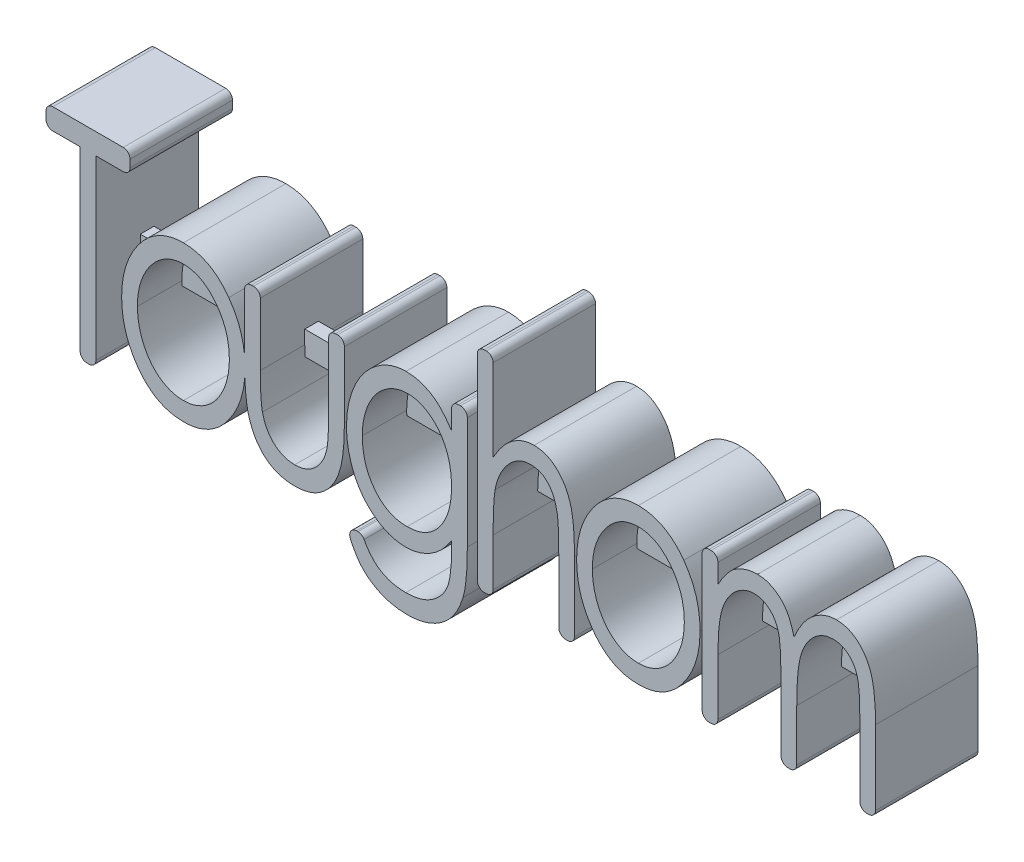
from build123d import *

# Parameters (mm, degrees)
SKETCH1_W           = 115
SKETCH1_H           = 3.5
BOSS_EXTRUDE1_DEPTH = 1
BOSS_EXTRUDE2_DEPTH = 7.5
FILLET10_R          = 1
BOSS_EXTRUDE3_DEPTH = 2
FILLET12_R          = 1


with BuildPart() as part:
    # Sketch1 → Boss-Extrude1 (new, symmetric)
    with BuildSketch(Plane.XY):
        Rectangle(SKETCH1_W, SKETCH1_H)
    extrude(amount=BOSS_EXTRUDE1_DEPTH, both=True)

    # Sketch2 → Boss-Extrude2 (add, symmetric)
    # profile 1 of 7: a face of its own
    with BuildSketch(Plane.XY):
        Polygon((-62.858031997, 14.923076923), (-62.858031997, 18), (-50.550339689, 18), (-50.550339689, 14.923076923), (-55.550339689, 14.923076923), (-55.550339689, -12), (-57.858031997, -12), (-57.858031997, 14.923076923), align=None)
    # profile 2 of 7: a face of its own
    with BuildSketch(Plane.XY):
        with BuildLine():
            add(Edge.make_bspline(
                [(-42.736637766, 10.307692308), (-42.409263923, 10.298740618), (-41.763692143, 10.281088145), (-40.819559803, 10.097580883), (-39.917803435, 9.814742237), (-39.054989577, 9.42441453), (-38.246546095, 8.902157468), (-37.472897868, 8.282226001), (-36.745989244, 7.542629901), (-36.316564213, 6.983223145), (-36.096012766, 6.695913462)],
                knots=[0, 0, 0, 0, 0.997600737, 1.967239891, 2.921995117, 3.876339565, 4.846055743, 5.850055787, 6.895794904, 8, 8, 8, 8], degree=3))
            add(Edge.make_bspline(
                [(-36.096012766, 6.695913462), (-35.904597218, 6.41866807), (-35.522033963, 5.864565226), (-35.041158438, 4.977646114), (-34.619936034, 4.060624866), (-34.283343934, 3.100774444), (-34.027451181, 2.102655282), (-33.840992187, 1.068428588), (-33.722646711, -0.00204681), (-33.710396667, -0.729656481), (-33.704185843, -1.098557692)],
                knots=[0, 0, 0, 0, 0.974492422, 1.947621278, 2.915467704, 3.892853539, 4.88708504, 5.894700399, 6.932604111, 8, 8, 8, 8], degree=3))
            add(Edge.make_bspline(
                [(-33.704185843, -1.098557692), (-33.713176409, -1.46940431), (-33.730908568, -2.200827774), (-33.844239125, -3.28065513), (-34.044937491, -4.324938564), (-34.319500349, -5.334566711), (-34.676197584, -6.310239889), (-35.115953435, -7.245313335), (-35.630121351, -8.149138297), (-36.218409013, -9.004070665), (-36.864426402, -9.793873704), (-37.566793046, -10.485855573), (-38.314068785, -11.075267355), (-39.113838683, -11.551333581), (-39.953700779, -11.928915161), (-40.840397543, -12.194320521), (-41.773357227, -12.353522586), (-42.411489211, -12.37412023), (-42.736637766, -12.384615385)],
                knots=[0, 0, 0, 0, 1.107894965, 2.185109244, 3.239066719, 4.281441704, 5.307577007, 6.338291467, 7.364845487, 8.410599108, 9.435040353, 10.408337498, 11.35046711, 12.27106388, 13.181883432, 14.094411748, 15.029042138, 16, 16, 16, 16], degree=3))
            add(Edge.make_bspline(
                [(-42.736637766, -12.384615385), (-43.061804994, -12.374181995), (-43.699973625, -12.353705571), (-44.634565299, -12.193301725), (-45.524003788, -11.930248909), (-46.365333092, -11.551118374), (-47.165501362, -11.075586406), (-47.912552212, -10.48386695), (-48.621063929, -9.796116193), (-49.266577085, -9.003753868), (-49.855255124, -8.149222162), (-50.369319504, -7.245290936), (-50.809103004, -6.310245867), (-51.165792829, -5.334565084), (-51.440357704, -4.324939008), (-51.641055519, -3.280655009), (-51.754386225, -2.200827805), (-51.772118364, -1.469404321), (-51.78110892, -1.098557692)],
                knots=[0, 0, 0, 0, 0.97035087, 1.904396978, 2.822082662, 3.732332818, 4.652354079, 5.593894721, 6.570857939, 7.594658757, 8.639758628, 9.6656709, 10.695741012, 11.721234828, 12.762958176, 13.816256772, 14.892797633, 16, 16, 16, 16], degree=3))
            add(Edge.make_bspline(
                [(-51.78110892, -1.098557692), (-51.774905501, -0.731643798), (-51.762637137, -0.006006344), (-51.643489543, 1.062201807), (-51.461029112, 2.096021133), (-51.192690647, 3.086689508), (-50.864563857, 4.046754672), (-50.446943576, 4.963133549), (-49.961376615, 5.847480599), (-49.580401055, 6.400472404), (-49.389281997, 6.677884615)],
                knots=[0, 0, 0, 0, 1.063876162, 2.104004247, 3.113779066, 4.10599887, 5.078075217, 6.053289624, 7.023419104, 8, 8, 8, 8], degree=3))
            add(Edge.make_bspline(
                [(-49.389281997, 6.677884615), (-49.169165257, 6.967613653), (-48.741484234, 7.530549534), (-48.009944394, 8.269124489), (-47.240400528, 8.899313236), (-46.423342687, 9.414909601), (-45.563347654, 9.816626366), (-44.659438047, 10.097002941), (-43.713693544, 10.281621688), (-43.06604951, 10.298902668), (-42.736637766, 10.307692308)],
                knots=[0, 0, 0, 0, 1.105877608, 2.148691041, 3.153713737, 4.125868282, 5.080095171, 6.03217926, 6.999105637, 8, 8, 8, 8], degree=3))
        make_face()
        with BuildLine():
            add(Edge.make_bspline(
                [(-42.742647381, 7.615384615), (-42.969560295, 7.607094273), (-43.418582101, 7.590689105), (-44.078549469, 7.465807077), (-44.712895673, 7.268292333), (-45.322555783, 6.986920656), (-45.90572899, 6.623247617), (-46.466983916, 6.183043013), (-46.998823912, 5.65774141), (-47.502310324, 5.065095844), (-47.962625282, 4.413225874), (-48.364675948, 3.720554819), (-48.710774283, 2.998450485), (-48.9856005, 2.238215651), (-49.212833485, 1.448621728), (-49.355117093, 0.620003865), (-49.459391677, -0.236537497), (-49.468686417, -0.819772075), (-49.473416612, -1.116586538)],
                knots=[0, 0, 0, 0, 0.892051984, 1.765218143, 2.632427219, 3.499707879, 4.398381485, 5.329923715, 6.299412897, 7.333506008, 8.385012576, 9.433681383, 10.480424421, 11.529892124, 12.610027243, 13.707297798, 14.833218744, 16, 16, 16, 16], degree=3))
            add(Edge.make_bspline(
                [(-49.473416612, -1.116586538), (-49.464557495, -1.4999776), (-49.447022399, -2.258834238), (-49.260842873, -3.372715125), (-48.991257552, -4.451722721), (-48.593645714, -5.471959163), (-48.105074625, -6.417470676), (-47.536878801, -7.268771774), (-46.87422839, -7.994452623), (-46.145730559, -8.608389632), (-45.353607995, -9.08853655), (-44.517237087, -9.435997987), (-43.643596622, -9.65831353), (-43.044442208, -9.680920522), (-42.742647381, -9.692307692)],
                knots=[0, 0, 0, 0, 1.139368929, 2.255184748, 3.350673064, 4.442866719, 5.503577089, 6.511720108, 7.47770502, 8.416871705, 9.336594054, 10.220769263, 11.103799257, 12, 12, 12, 12], degree=3))
            add(Edge.make_bspline(
                [(-42.742647381, -9.692307692), (-42.440832041, -9.680950864), (-41.841636901, -9.65840411), (-40.968298568, -9.435641682), (-40.132353082, -9.090553062), (-39.344729426, -8.604154234), (-38.610896282, -7.998883444), (-37.955159864, -7.266175806), (-37.385925958, -6.417864165), (-36.89724727, -5.471977989), (-36.501892143, -4.450743056), (-36.222470443, -3.373748881), (-36.038805116, -2.258696715), (-36.020916083, -1.499931441), (-36.01187815, -1.116586538)],
                knots=[0, 0, 0, 0, 0.896424748, 1.779675456, 2.664071664, 3.578931997, 4.522916774, 5.48514584, 6.493540845, 7.554516339, 8.646982988, 9.744251569, 10.860346286, 12, 12, 12, 12], degree=3))
            add(Edge.make_bspline(
                [(-36.01187815, -1.116586538), (-36.016864819, -0.819826798), (-36.026663525, -0.236699749), (-36.127333392, 0.620984495), (-36.282972801, 1.44658327), (-36.495592063, 2.240756223), (-36.782730164, 2.996999325), (-37.126310974, 3.720524529), (-37.528024574, 4.415177086), (-37.995647014, 5.063215717), (-38.498200515, 5.657890972), (-39.030211893, 6.183334678), (-39.590943633, 6.620964416), (-40.17081999, 6.990553477), (-40.781675464, 7.265231981), (-41.414266817, 7.467180998), (-42.070844219, 7.590038902), (-42.517778624, 7.606900793), (-42.742647381, 7.615384615)],
                knots=[0, 0, 0, 0, 1.167383154, 2.293884921, 3.393164049, 4.471755392, 5.524513002, 6.571796016, 7.621005792, 8.677622853, 9.712249415, 10.68223872, 11.614261498, 12.506704025, 13.381600122, 14.241739258, 15.11535585, 16, 16, 16, 16], degree=3))
        make_face(mode=Mode.SUBTRACT)
    # profile 3 of 7: a face of its own
    with BuildSketch(Plane.XY):
        with BuildLine():
            Line((-33.78110892, 9.923076923), (-31.473416612, 9.923076923))
            Line((-31.473416612, 9.923076923), (-31.473416612, -0.245192308))
            add(Edge.make_bspline(
                [(-31.473416612, -0.245192308), (-31.471791307, -0.543672032), (-31.468682376, -1.114612947), (-31.458240979, -1.936044729), (-31.435115912, -2.685427377), (-31.398576159, -3.362506888), (-31.356352799, -3.967554527), (-31.311130338, -4.499016541), (-31.253247368, -4.960703478), (-31.198353205, -5.241416926), (-31.172935843, -5.371394231)],
                knots=[0, 0, 0, 0, 1.39320863, 2.664971002, 3.834342125, 4.892401155, 5.829707442, 6.665228822, 7.381967762, 8, 8, 8, 8], degree=3))
            add(Edge.make_bspline(
                [(-31.172935843, -5.371394231), (-31.090235656, -5.691077146), (-30.930382483, -6.308999914), (-30.542508058, -7.158941811), (-30.068610041, -7.91238433), (-29.482453922, -8.546106566), (-28.8135447, -9.052237909), (-28.080444393, -9.430798683), (-27.279401636, -9.652279382), (-26.72515921, -9.678815876), (-26.443368535, -9.692307692)],
                knots=[0, 0, 0, 0, 1.137446325, 2.198597258, 3.209033332, 4.197093238, 5.159258895, 6.089718797, 7.028765383, 8, 8, 8, 8], degree=3))
            add(Edge.make_bspline(
                [(-26.443368535, -9.692307692), (-26.161548119, -9.67877566), (-25.611645152, -9.65237124), (-24.820347689, -9.435511066), (-24.098598186, -9.074508561), (-23.455035883, -8.57431037), (-22.887918334, -7.965796176), (-22.41954175, -7.254641853), (-22.039677789, -6.457514452), (-21.872085641, -5.883087325), (-21.785916612, -5.587740385)],
                knots=[0, 0, 0, 0, 1.005630283, 1.962239226, 2.906425724, 3.871218594, 4.858679764, 5.865048311, 6.902295138, 8, 8, 8, 8], degree=3))
            add(Edge.make_bspline(
                [(-21.785916612, -5.587740385), (-21.760708245, -5.467763681), (-21.704678329, -5.2010949), (-21.640538651, -4.753729454), (-21.587727656, -4.218354744), (-21.548715647, -3.592818656), (-21.511344671, -2.879743519), (-21.488445785, -2.078260327), (-21.478176854, -1.190733186), (-21.475050387, -0.569713817), (-21.473416612, -0.245192308)],
                knots=[0, 0, 0, 0, 0.548823579, 1.219854442, 2.02220492, 2.957136236, 4.025854258, 5.219327833, 6.546924667, 8, 8, 8, 8], degree=3))
            Line((-21.473416612, -0.245192308), (-21.473416612, 9.923076923))
            Line((-21.473416612, 9.923076923), (-19.165724304, 9.923076923))
            Line((-19.165724304, 9.923076923), (-19.165724304, -0.75))
            add(Edge.make_bspline(
                [(-19.165724304, -0.75), (-19.168108046, -1.112596296), (-19.172731919, -1.815943895), (-19.206085566, -2.838291827), (-19.275229125, -3.78971416), (-19.354740924, -4.674520265), (-19.469288824, -5.486282969), (-19.604142656, -6.231612694), (-19.774756483, -6.904285204), (-20.014681502, -7.700966343), (-20.390918631, -8.597909359), (-20.950496934, -9.560154391), (-21.612002636, -10.404056515), (-22.251690811, -11.000183588), (-22.810836053, -11.406170951), (-23.253321882, -11.672166366), (-23.727291287, -11.886797966), (-24.223116917, -12.068850817), (-24.745429811, -12.213185326), (-25.29431331, -12.31432012), (-25.867016449, -12.376061087), (-26.256912386, -12.381729762), (-26.455387766, -12.384615385)],
                knots=[0, 0, 0, 0, 1.397698989, 2.71119214, 3.94186471, 5.07439274, 6.134732057, 7.100953584, 7.992391407, 8.808183655, 10.30677533, 11.729105738, 13.086992076, 14.425597192, 15.083568239, 15.748345675, 16.411686529, 17.08590401, 17.782777766, 18.49760152, 19.235208472, 20, 20, 20, 20], degree=3))
            add(Edge.make_bspline(
                [(-26.455387766, -12.384615385), (-26.655870243, -12.381795846), (-27.047777216, -12.376284158), (-27.622460309, -12.31428151), (-28.171397599, -12.213325829), (-28.695332959, -12.067842459), (-29.195269028, -11.886630415), (-29.67440634, -11.673978143), (-30.118555598, -11.404168727), (-30.683621577, -11.003607702), (-31.323448683, -10.400760987), (-31.993282443, -9.555286079), (-32.54779155, -8.577531484), (-32.932736402, -7.67389936), (-33.172682126, -6.866283787), (-33.343562658, -6.17964199), (-33.478318662, -5.4184182), (-33.583291928, -4.583549334), (-33.67366618, -3.679933948), (-33.740367552, -2.701994574), (-33.774282148, -1.651691606), (-33.778783983, -0.926303634), (-33.78110892, -0.551682692)],
                knots=[0, 0, 0, 0, 0.761697072, 1.488979974, 2.193798567, 2.880918402, 3.552854222, 4.213830995, 4.869303753, 5.524245692, 6.844114778, 8.193689523, 9.609276736, 11.103879885, 11.915535245, 12.809275975, 13.79192487, 14.851494079, 16.006797852, 17.243032265, 18.576185586, 20, 20, 20, 20], degree=3))
            Line((-33.78110892, -0.551682692), (-33.78110892, 9.923076923))
        make_face()
    # profile 4 of 7: a face of its own
    with BuildSketch(Plane.XY):
        with BuildLine():
            Line((-3.473416612, 9.923076923), (-1.165724304, 9.923076923))
            Line((-1.165724304, 9.923076923), (-1.165724304, -7.474759615))
            add(Edge.make_bspline(
                [(-1.165724304, -7.474759615), (-1.168322861, -7.845373303), (-1.173338254, -8.560682971), (-1.203337699, -9.594569275), (-1.250901108, -10.55034612), (-1.314377, -11.430502845), (-1.403713171, -12.23230251), (-1.512894302, -12.957681765), (-1.631995151, -13.607777782), (-1.743933064, -14.009858623), (-1.79673392, -14.199519231)],
                knots=[0, 0, 0, 0, 1.313140422, 2.534450483, 3.664403049, 4.703595704, 5.660619967, 6.521865474, 7.302767341, 8, 8, 8, 8], degree=3))
            add(Edge.make_bspline(
                [(-1.79673392, -14.199519231), (-1.873530886, -14.445054549), (-2.023859403, -14.925685003), (-2.302098536, -15.615267736), (-2.621802939, -16.258815488), (-2.975870786, -16.863757497), (-3.374025276, -17.424733278), (-3.814156207, -17.943720349), (-4.294738366, -18.418376928), (-4.813312669, -18.84721248), (-5.366391795, -19.224135007), (-5.94528959, -19.554946688), (-6.546925797, -19.843460751), (-7.184715858, -20.060414907), (-7.843605359, -20.244927984), (-8.533955382, -20.367630979), (-9.248652091, -20.449945694), (-9.735194788, -20.457638746), (-9.981830074, -20.461538462)],
                knots=[0, 0, 0, 0, 1.107820952, 2.168537256, 3.198846454, 4.200688666, 5.184684931, 6.158030749, 7.128158633, 8.090426733, 9.052540079, 10.00719567, 10.960602632, 11.921205807, 12.905012897, 13.905218839, 14.938126187, 16, 16, 16, 16], degree=3))
            add(Edge.make_bspline(
                [(-9.981830074, -20.461538462), (-10.341120795, -20.454104891), (-11.045260844, -20.439536536), (-12.070372866, -20.27223342), (-13.045910545, -20.035340775), (-13.953396518, -19.674347831), (-14.792658608, -19.238411317), (-15.555975145, -18.732276669), (-16.236188319, -18.156018022), (-16.848540234, -17.49776736), (-17.395215708, -16.716512697), (-17.919286031, -15.802282989), (-18.41543262, -14.729023665), (-18.705294495, -13.949314997), (-18.858031997, -13.538461538)],
                knots=[0, 0, 0, 0, 1.061461245, 2.080257931, 3.064468628, 4.02485726, 4.960198824, 5.857294517, 6.727321677, 7.590891131, 8.508180099, 9.540561569, 10.704043154, 12, 12, 12, 12], degree=3))
            Line((-18.858031997, -13.538461538), (-16.550339689, -13.538461538))
            add(Edge.make_bspline(
                [(-16.550339689, -13.538461538), (-16.385420982, -13.880330552), (-16.067677226, -14.538998975), (-15.454751782, -15.40949149), (-14.789577121, -16.155389609), (-14.037537515, -16.75783062), (-13.197671069, -17.213605537), (-12.273303394, -17.539563377), (-11.255884737, -17.73352664), (-10.547607196, -17.757034639), (-10.180147381, -17.769230769)],
                knots=[0, 0, 0, 0, 1.114872187, 2.147989655, 3.119954139, 4.046708054, 4.967088834, 5.917649145, 6.919660421, 8, 8, 8, 8], degree=3))
            add(Edge.make_bspline(
                [(-10.180147381, -17.769230769), (-9.816728966, -17.756754072), (-9.112530317, -17.732577879), (-8.100689661, -17.540559113), (-7.178818829, -17.212779733), (-6.35278168, -16.761422162), (-5.633982458, -16.204984808), (-5.011929644, -15.584504297), (-4.507230072, -14.891088519), (-4.178402248, -14.252150866), (-3.97352501, -13.686085266), (-3.834749378, -13.196591741), (-3.722502253, -12.641980769), (-3.635565869, -12.02352232), (-3.563912522, -11.34199467), (-3.509264224, -10.596520658), (-3.48153148, -9.786669013), (-3.476184695, -9.225578294), (-3.473416612, -8.935096154)],
                knots=[0, 0, 0, 0, 1.36762604, 2.650059459, 3.859538652, 5.037496523, 6.177915287, 7.271197492, 8.334730679, 9.393869082, 9.96412834, 10.599183379, 11.307692762, 12.092716274, 12.949757719, 13.887429513, 14.906301644, 16, 16, 16, 16], degree=3))
            Line((-3.473416612, -8.935096154), (-3.473416612, -7.799278846))
            add(Edge.make_bspline(
                [(-3.473416612, -7.799278846), (-3.683215601, -8.122417649), (-4.092864277, -8.753371035), (-4.806754653, -9.604980977), (-5.597931562, -10.327982869), (-6.447319959, -10.932414241), (-7.341744305, -11.409868238), (-8.272284031, -11.748725109), (-9.230771738, -11.964306978), (-9.882548368, -11.988059596), (-10.210195458, -12)],
                knots=[0, 0, 0, 0, 1.112344582, 2.171938421, 3.200042036, 4.20040838, 5.176389856, 6.119262147, 7.054556032, 8, 8, 8, 8], degree=3))
            add(Edge.make_bspline(
                [(-10.210195458, -12), (-10.402754267, -11.995527703), (-10.787213741, -11.986598395), (-11.357413685, -11.909959386), (-11.919127013, -11.798646955), (-12.470945854, -11.632265984), (-13.016647844, -11.42408569), (-13.551354731, -11.163131713), (-14.078040564, -10.860888208), (-14.765142594, -10.397331439), (-15.567692883, -9.717037834), (-16.422182962, -8.771015534), (-17.160540515, -7.695650355), (-17.775372895, -6.50154451), (-18.257944819, -5.211421712), (-18.608562559, -3.852178088), (-18.815295303, -2.429017612), (-18.843613821, -1.459810954), (-18.858031997, -0.966346154)],
                knots=[0, 0, 0, 0, 0.594341688, 1.186651984, 1.773804182, 2.360956381, 2.964053426, 3.575467705, 4.196167306, 4.83781174, 6.132750582, 7.43346793, 8.763219087, 10.149283478, 11.570458848, 13.007737375, 14.476510383, 16, 16, 16, 16], degree=3))
            add(Edge.make_bspline(
                [(-18.858031997, -0.966346154), (-18.844463325, -0.470780255), (-18.817687244, 0.507157294), (-18.59589871, 1.948488795), (-18.22686867, 3.334913014), (-17.725873495, 4.660381892), (-17.095974304, 5.89366415), (-16.341425683, 7.003239433), (-15.473558656, 7.973593953), (-14.666461101, 8.672583426), (-13.973832919, 9.142598151), (-13.453048045, 9.461761484), (-12.915369191, 9.71412065), (-12.379519909, 9.939047239), (-11.82956949, 10.096540158), (-11.276226364, 10.219438961), (-10.715013759, 10.293759107), (-10.338613886, 10.303042734), (-10.150099304, 10.307692308)],
                knots=[0, 0, 0, 0, 1.510333041, 2.980454055, 4.433745133, 5.877714865, 7.292653904, 8.646179562, 9.956790963, 11.251884508, 11.888853666, 12.507884788, 13.111570812, 13.697923113, 14.277653727, 14.852668118, 15.425374966, 16, 16, 16, 16], degree=3))
            add(Edge.make_bspline(
                [(-10.150099304, 10.307692308), (-9.840811544, 10.295756045), (-9.225335863, 10.272003152), (-8.321622467, 10.093164798), (-7.44913627, 9.800335537), (-6.602090418, 9.387550501), (-5.774226129, 8.824045521), (-4.980768189, 8.074792577), (-4.197707863, 7.155972587), (-3.722981243, 6.456602441), (-3.473416612, 6.088942308)],
                knots=[0, 0, 0, 0, 0.896261828, 1.78354086, 2.659572562, 3.558258425, 4.50704087, 5.550932766, 6.712520985, 8, 8, 8, 8], degree=3))
            Line((-3.473416612, 6.088942308), (-3.473416612, 9.923076923))
        make_face()
        with BuildLine():
            add(Edge.make_bspline(
                [(-9.867647381, 7.615384615), (-10.16559201, 7.602106684), (-10.757481464, 7.575729073), (-11.624257398, 7.343712154), (-12.463815991, 6.990701727), (-13.25125384, 6.478788803), (-13.98873282, 5.855819891), (-14.638966993, 5.10537409), (-15.214394502, 4.253969294), (-15.688811334, 3.297713074), (-16.070092058, 2.271891743), (-16.347427143, 1.192655143), (-16.521562539, 0.072985767), (-16.540678358, -0.689268245), (-16.550339689, -1.074519231)],
                knots=[0, 0, 0, 0, 0.881567456, 1.751300174, 2.642352789, 3.571269243, 4.523051295, 5.494861872, 6.504265702, 7.56101116, 8.65058581, 9.742099782, 10.858834103, 12, 12, 12, 12], degree=3))
            add(Edge.make_bspline(
                [(-16.550339689, -1.074519231), (-16.544222936, -1.365173085), (-16.53221637, -1.93569708), (-16.448051895, -2.773742477), (-16.304553466, -3.571240279), (-16.10557104, -4.331630589), (-15.847396288, -5.05116094), (-15.534156988, -5.736263056), (-15.160429558, -6.379180333), (-14.735681392, -6.980182844), (-14.263855181, -7.522773264), (-13.759384815, -8.004655873), (-13.210749962, -8.402571049), (-12.635101034, -8.737400386), (-12.018927839, -8.989174115), (-11.373539343, -9.179002985), (-10.690604078, -9.287238346), (-10.224584307, -9.300801854), (-9.987839689, -9.307692308)],
                knots=[0, 0, 0, 0, 1.185092797, 2.326216796, 3.430133097, 4.486139392, 5.527352502, 6.543398971, 7.553518233, 8.555280487, 9.539607774, 10.481504186, 11.393127888, 12.296849685, 13.190325208, 14.10026404, 15.034907329, 16, 16, 16, 16], degree=3))
            add(Edge.make_bspline(
                [(-9.987839689, -9.307692308), (-9.749049173, -9.300947579), (-9.27896118, -9.287669767), (-8.593175592, -9.17772557), (-7.943486662, -8.997182956), (-7.331883443, -8.742948537), (-6.754078657, -8.414755739), (-6.215027756, -8.011123167), (-5.711132729, -7.537288681), (-5.251476541, -6.994770592), (-4.829914352, -6.398013799), (-4.472777515, -5.743083885), (-4.156659578, -5.052442958), (-3.903754633, -4.313691152), (-3.713317081, -3.52862439), (-3.576875497, -2.698929795), (-3.490808911, -1.823511998), (-3.479309087, -1.224963641), (-3.473416612, -0.918269231)],
                knots=[0, 0, 0, 0, 0.961728615, 1.89327902, 2.790232961, 3.673131094, 4.555143301, 5.460771347, 6.380107747, 7.336129127, 8.321381253, 9.318595388, 10.337300541, 11.378743002, 12.4593598, 13.588591198, 14.764401252, 16, 16, 16, 16], degree=3))
            add(Edge.make_bspline(
                [(-3.473416612, -0.918269231), (-3.484284271, -0.519172599), (-3.505444591, 0.257904785), (-3.656238849, 1.392240624), (-3.913377295, 2.458121154), (-4.273689677, 3.454430509), (-4.729194553, 4.364773641), (-5.263703584, 5.190773817), (-5.901457942, 5.901516722), (-6.607888983, 6.509329294), (-7.372267474, 6.998465761), (-8.173884232, 7.360096962), (-9.013594682, 7.571203903), (-9.582061204, 7.600611053), (-9.867647381, 7.615384615)],
                knots=[0, 0, 0, 0, 1.213241772, 2.362291902, 3.471660017, 4.540966306, 5.575987332, 6.560799048, 7.522803651, 8.468788627, 9.38620783, 10.272365513, 11.132071088, 12, 12, 12, 12], degree=3))
        make_face(mode=Mode.SUBTRACT)
    # profile 5 of 7: a face of its own
    with BuildSketch(Plane.XY):
        with BuildLine():
            Line((0.295814157, 18.769230769), (2.603506465, 18.769230769))
            Line((2.603506465, 18.769230769), (2.603506465, 5.782451923))
            add(Edge.make_bspline(
                [(2.603506465, 5.782451923), (2.81125157, 6.141232882), (3.209449811, 6.828931141), (3.88812361, 7.75308812), (4.586944903, 8.543035525), (5.328225934, 9.184815141), (6.102853186, 9.684338036), (6.911738824, 10.046815062), (7.756429435, 10.264553128), (8.33145463, 10.293307106), (8.619131465, 10.307692308)],
                knots=[0, 0, 0, 0, 1.256690491, 2.408778505, 3.471454159, 4.449464431, 5.373097068, 6.257150511, 7.128077468, 8, 8, 8, 8], degree=3))
            add(Edge.make_bspline(
                [(8.619131465, 10.307692308), (8.911020741, 10.292469047), (9.487963967, 10.262379016), (10.327713743, 10.027219836), (11.107249739, 9.624740402), (11.829846772, 9.081186764), (12.473221291, 8.402960738), (13.049573459, 7.623649809), (13.504266022, 6.720590532), (13.823183712, 5.897121894), (14.02730903, 5.159740426), (14.163529478, 4.525742694), (14.277562939, 3.817672431), (14.364653342, 3.035242375), (14.43537202, 2.179473632), (14.49077752, 1.249823372), (14.518428543, 0.247764476), (14.523803315, -0.445499421), (14.526583388, -0.804086538)],
                knots=[0, 0, 0, 0, 0.996176206, 1.969024424, 2.951356124, 3.977766322, 5.042421952, 6.134626154, 7.27621498, 8.484766679, 9.145542465, 9.887750523, 10.698838309, 11.594295832, 12.576246137, 13.63182529, 14.775074044, 16, 16, 16, 16], degree=3))
            Line((14.526583388, -0.804086538), (14.526583388, -12))
            Line((14.526583388, -12), (12.21889108, -12))
            Line((12.21889108, -12), (12.21889108, -1.6875))
            add(Edge.make_bspline(
                [(12.21889108, -1.6875), (12.216594359, -1.389027129), (12.212201291, -0.818121414), (12.210524118, -0.000683876), (12.190348606, 0.740491625), (12.167920663, 1.403672233), (12.137402785, 1.988640905), (12.104582045, 2.496072282), (12.056019498, 2.92457416), (12.019063167, 3.184363599), (12.002544926, 3.300480769)],
                knots=[0, 0, 0, 0, 1.433671176, 2.74226285, 3.926088526, 4.994794622, 5.929342253, 6.739627381, 7.436655691, 8, 8, 8, 8], degree=3))
            add(Edge.make_bspline(
                [(12.002544926, 3.300480769), (11.936278203, 3.638954843), (11.81056373, 4.28107335), (11.510939307, 5.165353248), (11.133574368, 5.918763512), (10.672817933, 6.536793512), (10.136552568, 7.028364158), (9.511741846, 7.369864387), (8.813074362, 7.582618223), (8.320220851, 7.604241732), (8.06624685, 7.615384615)],
                knots=[0, 0, 0, 0, 1.286018597, 2.439703376, 3.472813688, 4.417745281, 5.301809853, 6.165149782, 7.05447716, 8, 8, 8, 8], degree=3))
            add(Edge.make_bspline(
                [(8.06624685, 7.615384615), (7.91568266, 7.61123222), (7.616474941, 7.6029804), (7.174005893, 7.5221061), (6.74612427, 7.387105792), (6.324849391, 7.208819491), (5.925817451, 6.960041118), (5.522465617, 6.68257117), (5.147388751, 6.333384754), (4.656507997, 5.811264905), (4.102912392, 5.070906806), (3.569269148, 4.074282869), (3.144108043, 2.983476649), (2.977418254, 2.207754761), (2.891968003, 1.810096154)],
                knots=[0, 0, 0, 0, 0.644825769, 1.28142587, 1.919587189, 2.565555052, 3.235497232, 3.931132674, 4.660544456, 5.425856618, 7.00215079, 8.604141558, 10.259179793, 12, 12, 12, 12], degree=3))
            add(Edge.make_bspline(
                [(2.891968003, 1.810096154), (2.868956724, 1.664001373), (2.818648635, 1.344603698), (2.759540272, 0.821456512), (2.714443439, 0.211899902), (2.670878516, -0.481140846), (2.644034983, -1.260709249), (2.61795658, -2.122037512), (2.608447623, -3.069694562), (2.605202796, -3.728767133), (2.603506465, -4.073317308)],
                knots=[0, 0, 0, 0, 0.601974854, 1.316059127, 2.1422104, 3.089815509, 4.142494093, 5.317148409, 6.597457965, 8, 8, 8, 8], degree=3))
            Line((2.603506465, -4.073317308), (2.603506465, -12))
            Line((2.603506465, -12), (0.295814157, -12))
            Line((0.295814157, -12), (0.295814157, 18.769230769))
        make_face()
    # profile 6 of 7: a face of its own
    with BuildSketch(Plane.XY):
        with BuildLine():
            add(Edge.make_bspline(
                [(23.87874685, 10.307692308), (24.206120693, 10.298740618), (24.851692473, 10.281088145), (25.795824812, 10.097580883), (26.69758118, 9.814742237), (27.560395038, 9.42441453), (28.36883852, 8.902157468), (29.142486748, 8.282226001), (29.869395371, 7.542629901), (30.298820402, 6.983223145), (30.51937185, 6.695913462)],
                knots=[0, 0, 0, 0, 0.997600737, 1.967239891, 2.921995117, 3.876339565, 4.846055743, 5.850055787, 6.895794904, 8, 8, 8, 8], degree=3))
            add(Edge.make_bspline(
                [(30.51937185, 6.695913462), (30.710787397, 6.41866807), (31.093350652, 5.864565226), (31.574226178, 4.977646114), (31.995448581, 4.060624866), (32.332040681, 3.100774444), (32.587933435, 2.102655282), (32.774392428, 1.068428588), (32.892737904, -0.00204681), (32.904987948, -0.729656481), (32.911198773, -1.098557692)],
                knots=[0, 0, 0, 0, 0.974492422, 1.947621278, 2.915467704, 3.892853539, 4.88708504, 5.894700399, 6.932604111, 8, 8, 8, 8], degree=3))
            add(Edge.make_bspline(
                [(32.911198773, -1.098557692), (32.902208206, -1.46940431), (32.884476047, -2.200827774), (32.771145491, -3.28065513), (32.570447125, -4.324938564), (32.295884266, -5.334566711), (31.939187031, -6.310239889), (31.499431181, -7.245313335), (30.985263265, -8.149138297), (30.396975602, -9.004070665), (29.750958213, -9.793873704), (29.04859157, -10.485855573), (28.301315831, -11.075267355), (27.501545933, -11.551333581), (26.661683836, -11.928915161), (25.774987072, -12.194320521), (24.842027388, -12.353522586), (24.203895404, -12.37412023), (23.87874685, -12.384615385)],
                knots=[0, 0, 0, 0, 1.107894965, 2.185109244, 3.239066719, 4.281441704, 5.307577007, 6.338291467, 7.364845487, 8.410599108, 9.435040353, 10.408337498, 11.35046711, 12.27106388, 13.181883432, 14.094411748, 15.029042138, 16, 16, 16, 16], degree=3))
            add(Edge.make_bspline(
                [(23.87874685, -12.384615385), (23.553579622, -12.374181995), (22.915410991, -12.353705571), (21.980819316, -12.193301725), (21.091380828, -11.930248909), (20.250051523, -11.551118374), (19.449883254, -11.075586406), (18.702832404, -10.48386695), (17.994320686, -9.796116193), (17.34880753, -9.003753868), (16.760129492, -8.149222162), (16.246065111, -7.245290936), (15.806281612, -6.310245867), (15.449591787, -5.334565084), (15.175026911, -4.324939008), (14.974329096, -3.280655009), (14.86099839, -2.200827805), (14.843266252, -1.469404321), (14.834275696, -1.098557692)],
                knots=[0, 0, 0, 0, 0.97035087, 1.904396978, 2.822082662, 3.732332818, 4.652354079, 5.593894721, 6.570857939, 7.594658757, 8.639758628, 9.6656709, 10.695741012, 11.721234828, 12.762958176, 13.816256772, 14.892797633, 16, 16, 16, 16], degree=3))
            add(Edge.make_bspline(
                [(14.834275696, -1.098557692), (14.840479115, -0.731643798), (14.852747478, -0.006006344), (14.971895073, 1.062201807), (15.154355503, 2.096021133), (15.422693968, 3.086689508), (15.750820758, 4.046754672), (16.16844104, 4.963133549), (16.654008001, 5.847480599), (17.034983561, 6.400472404), (17.226102619, 6.677884615)],
                knots=[0, 0, 0, 0, 1.063876162, 2.104004247, 3.113779066, 4.10599887, 5.078075217, 6.053289624, 7.023419104, 8, 8, 8, 8], degree=3))
            add(Edge.make_bspline(
                [(17.226102619, 6.677884615), (17.446219359, 6.967613653), (17.873900382, 7.530549534), (18.605440222, 8.269124489), (19.374984087, 8.899313236), (20.192041928, 9.414909601), (21.052036961, 9.816626366), (21.955946568, 10.097002941), (22.901691072, 10.281621688), (23.549335105, 10.298902668), (23.87874685, 10.307692308)],
                knots=[0, 0, 0, 0, 1.105877608, 2.148691041, 3.153713737, 4.125868282, 5.080095171, 6.03217926, 6.999105637, 8, 8, 8, 8], degree=3))
        make_face()
        with BuildLine():
            add(Edge.make_bspline(
                [(23.872737234, 7.615384615), (23.64582432, 7.607094273), (23.196802514, 7.590689105), (22.536835146, 7.465807077), (21.902488942, 7.268292333), (21.292828833, 6.986920656), (20.709655625, 6.623247617), (20.148400699, 6.183043013), (19.616560703, 5.65774141), (19.113074291, 5.065095844), (18.652759333, 4.413225874), (18.250708668, 3.720554819), (17.904610332, 2.998450485), (17.629784115, 2.238215651), (17.40255113, 1.448621728), (17.260267522, 0.620003865), (17.155992938, -0.236537497), (17.146698198, -0.819772075), (17.141968003, -1.116586538)],
                knots=[0, 0, 0, 0, 0.892051984, 1.765218143, 2.632427219, 3.499707879, 4.398381485, 5.329923715, 6.299412897, 7.333506008, 8.385012576, 9.433681383, 10.480424421, 11.529892124, 12.610027243, 13.707297798, 14.833218744, 16, 16, 16, 16], degree=3))
            add(Edge.make_bspline(
                [(17.141968003, -1.116586538), (17.15082712, -1.4999776), (17.168362217, -2.258834238), (17.354541742, -3.372715125), (17.624127064, -4.451722721), (18.021738902, -5.471959163), (18.51030999, -6.417470676), (19.078505815, -7.268771774), (19.741156225, -7.994452623), (20.469654056, -8.608389632), (21.26177662, -9.08853655), (22.098147529, -9.435997987), (22.971787993, -9.65831353), (23.570942408, -9.680920522), (23.872737234, -9.692307692)],
                knots=[0, 0, 0, 0, 1.139368929, 2.255184748, 3.350673064, 4.442866719, 5.503577089, 6.511720108, 7.47770502, 8.416871705, 9.336594054, 10.220769263, 11.103799257, 12, 12, 12, 12], degree=3))
            add(Edge.make_bspline(
                [(23.872737234, -9.692307692), (24.174552574, -9.680950864), (24.773747714, -9.65840411), (25.647086047, -9.435641682), (26.483031533, -9.090553062), (27.270655189, -8.604154234), (28.004488333, -7.998883444), (28.660224752, -7.266175806), (29.229458658, -6.417864165), (29.718137346, -5.471977989), (30.113492473, -4.450743056), (30.392914173, -3.373748881), (30.576579499, -2.258696715), (30.594468532, -1.499931441), (30.603506465, -1.116586538)],
                knots=[0, 0, 0, 0, 0.896424748, 1.779675456, 2.664071664, 3.578931997, 4.522916774, 5.48514584, 6.493540845, 7.554516339, 8.646982988, 9.744251569, 10.860346286, 12, 12, 12, 12], degree=3))
            add(Edge.make_bspline(
                [(30.603506465, -1.116586538), (30.598519796, -0.819826798), (30.588721091, -0.236699749), (30.488051224, 0.620984495), (30.332411814, 1.44658327), (30.119792553, 2.240756223), (29.832654451, 2.996999325), (29.489073641, 3.720524529), (29.087360041, 4.415177086), (28.619737602, 5.063215717), (28.1171841, 5.657890972), (27.585172723, 6.183334678), (27.024440982, 6.620964416), (26.444564625, 6.990553477), (25.833709151, 7.265231981), (25.201117798, 7.467180998), (24.544540396, 7.590038902), (24.097605991, 7.606900793), (23.872737234, 7.615384615)],
                knots=[0, 0, 0, 0, 1.167383154, 2.293884921, 3.393164049, 4.471755392, 5.524513002, 6.571796016, 7.621005792, 8.677622853, 9.712249415, 10.68223872, 11.614261498, 12.506704025, 13.381600122, 14.241739258, 15.11535585, 16, 16, 16, 16], degree=3))
        make_face(mode=Mode.SUBTRACT)
    # profile 7 of 7: a face of its own
    with BuildSketch(Plane.XY):
        with BuildLine():
            Line((33.21889108, 9.923076923), (35.526583388, 9.923076923))
            Line((35.526583388, 9.923076923), (35.526583388, 6.112980769))
            add(Edge.make_bspline(
                [(35.526583388, 6.112980769), (35.711054235, 6.445146268), (36.061300416, 7.075813387), (36.648322619, 7.915587894), (37.22516136, 8.631219501), (37.654939692, 9.014528601), (37.858314157, 9.195913462)],
                knots=[0, 0, 0, 0, 1.171933473, 2.225095347, 3.16010125, 4, 4, 4, 4], degree=3))
            add(Edge.make_bspline(
                [(37.858314157, 9.195913462), (38.132318076, 9.366513647), (38.667568425, 9.699770957), (39.533235543, 10.050967317), (40.420181705, 10.26308201), (41.02024572, 10.292836261), (41.319852619, 10.307692308)],
                knots=[0, 0, 0, 0, 1.048657587, 2.048490186, 3.025627617, 4, 4, 4, 4], degree=3))
            add(Edge.make_bspline(
                [(41.319852619, 10.307692308), (41.522617201, 10.2984915), (41.927274086, 10.280129465), (42.525456322, 10.16634158), (43.103500255, 9.962061099), (43.659373748, 9.685938895), (44.183271867, 9.346620538), (44.663538149, 8.951949932), (45.093793559, 8.505994516), (45.471920205, 7.992264443), (45.824247249, 7.404190042), (46.127527091, 6.705558379), (46.42853418, 5.903828202), (46.585417243, 5.321356069), (46.668410311, 5.013221154)],
                knots=[0, 0, 0, 0, 0.894318559, 1.784789816, 2.673155522, 3.589665775, 4.515830902, 5.419523397, 6.325415028, 7.240562059, 8.226788069, 9.341658935, 10.593704917, 12, 12, 12, 12], degree=3))
            add(Edge.make_bspline(
                [(46.668410311, 5.013221154), (46.852105972, 5.424205565), (47.20499611, 6.213730722), (47.852358302, 7.28469835), (48.561916314, 8.203392574), (49.339229815, 8.963190274), (50.17279579, 9.555748412), (51.040820791, 9.994622303), (51.949632032, 10.258391058), (52.568219581, 10.291300066), (52.876343003, 10.307692308)],
                knots=[0, 0, 0, 0, 1.247522168, 2.39656325, 3.461211686, 4.459136641, 5.39944971, 6.286422375, 7.146453235, 8, 8, 8, 8], degree=3))
            add(Edge.make_bspline(
                [(52.876343003, 10.307692308), (53.160028451, 10.293631443), (53.71941753, 10.265905332), (54.533469681, 10.050648873), (55.288578805, 9.679555357), (55.987756818, 9.178536885), (56.615176293, 8.547780375), (57.157242272, 7.799577019), (57.618445043, 6.94179555), (57.917868456, 6.14051759), (58.115223851, 5.427945388), (58.244526618, 4.821536195), (58.360525204, 4.15237755), (58.446207341, 3.419811951), (58.520680615, 2.624523273), (58.565054863, 1.764418939), (58.595996768, 0.840770141), (58.600951668, 0.203554784), (58.603506465, -0.125)],
                knots=[0, 0, 0, 0, 1.021070567, 2.013412143, 3.007378834, 4.036575433, 5.097825748, 6.197552405, 7.353325105, 8.595615841, 9.269603917, 10.015462958, 10.828037795, 11.714963733, 12.671344109, 13.704781296, 14.81656166, 16, 16, 16, 16], degree=3))
            Line((58.603506465, -0.125), (58.603506465, -12))
            Line((58.603506465, -12), (56.295814157, -12))
            Line((56.295814157, -12), (56.295814157, -0.112980769))
            add(Edge.make_bspline(
                [(56.295814157, -0.112980769), (56.294749051, 0.16747807), (56.292702285, 0.706422975), (56.274848456, 1.479798351), (56.245422375, 2.185104871), (56.204465931, 2.820404939), (56.151202516, 3.387712337), (56.085935698, 3.886990166), (56.010895327, 4.31899135), (55.89161779, 4.79622315), (55.706114072, 5.323462581), (55.413062426, 5.891918767), (55.045055703, 6.391588778), (54.621254567, 6.827702503), (54.132653668, 7.17737884), (53.596828877, 7.43452687), (53.013328372, 7.591279219), (52.608893545, 7.607215699), (52.401583388, 7.615384615)],
                knots=[0, 0, 0, 0, 1.379909185, 2.651708276, 3.805941215, 4.852978562, 5.783702266, 6.608923511, 7.330047616, 7.939622565, 9.027610697, 10.072418919, 11.073883027, 12.070533896, 13.052455124, 14.013527241, 14.981749467, 16, 16, 16, 16], degree=3))
            add(Edge.make_bspline(
                [(52.401583388, 7.615384615), (52.145324405, 7.602711148), (51.632373747, 7.577342814), (50.888928733, 7.331928754), (50.177482132, 6.954764347), (49.523949205, 6.418861581), (48.923389675, 5.771172752), (48.402373922, 5.012289302), (47.979315548, 4.149698578), (47.690355049, 3.358143878), (47.510159174, 2.645304393), (47.392180822, 2.018966517), (47.291482817, 1.309012719), (47.208568242, 0.51515034), (47.144070068, -0.362682637), (47.094721582, -1.324409942), (47.074835957, -2.370515771), (47.068391459, -3.095751559), (47.065044926, -3.472355769)],
                knots=[0, 0, 0, 0, 0.898028184, 1.79757268, 2.72350492, 3.715183115, 4.751339907, 5.81945548, 6.937089224, 8.119533788, 8.773471509, 9.519018729, 10.358283575, 11.292740113, 12.323454074, 13.451218336, 14.676455408, 16, 16, 16, 16], degree=3))
            Line((47.065044926, -3.472355769), (47.065044926, -12))
            Line((47.065044926, -12), (44.757352619, -12))
            Line((44.757352619, -12), (44.757352619, -0.852163462))
            add(Edge.make_bspline(
                [(44.757352619, -0.852163462), (44.756275928, -0.537651987), (44.754204649, 0.067388139), (44.736483042, 0.934909129), (44.706896149, 1.724308207), (44.666581902, 2.433786081), (44.610966099, 3.062644389), (44.55514735, 3.614834177), (44.478737487, 4.086452804), (44.36013086, 4.603652575), (44.174417093, 5.167289772), (43.888129292, 5.779083317), (43.516407516, 6.311553168), (43.083573855, 6.770193937), (42.596038562, 7.148176441), (42.055238519, 7.424125199), (41.46312758, 7.584764278), (41.054399636, 7.605014581), (40.845093003, 7.615384615)],
                knots=[0, 0, 0, 0, 1.442659481, 2.775310106, 3.979909877, 5.066085876, 6.034440002, 6.875647806, 7.611320077, 8.224284655, 9.308126128, 10.327370997, 11.311251607, 12.273219661, 13.210514908, 14.126903344, 15.040800711, 16, 16, 16, 16], degree=3))
            add(Edge.make_bspline(
                [(40.845093003, 7.615384615), (40.598878648, 7.602311368), (40.106204303, 7.576151829), (39.387293836, 7.33506546), (38.694883785, 6.963071321), (38.037732805, 6.448769956), (37.432442656, 5.815826179), (36.915852405, 5.064729878), (36.472787825, 4.22084509), (36.179738407, 3.438187551), (35.991945989, 2.743303086), (35.866225369, 2.149447648), (35.757684787, 1.489935513), (35.679476329, 0.763158515), (35.603051201, -0.027653905), (35.557402079, -0.883726433), (35.536100206, -1.807581242), (35.529834199, -2.44470168), (35.526583388, -2.775240385)],
                knots=[0, 0, 0, 0, 0.91128202, 1.82347317, 2.784601502, 3.817986041, 4.906375212, 6.022042265, 7.189149255, 8.435921352, 9.113974711, 9.859010574, 10.687587681, 11.593060163, 12.570945671, 13.635620039, 14.773357369, 16, 16, 16, 16], degree=3))
            Line((35.526583388, -2.775240385), (35.526583388, -12))
            Line((35.526583388, -12), (33.21889108, -12))
            Line((33.21889108, -12), (33.21889108, 9.923076923))
        make_face()
    extrude(amount=BOSS_EXTRUDE2_DEPTH, both=True)

    # Fillet10
    fillet10_edges = [part.edges().sort_by_distance(p)[0] for p in [
        (58.603506465, -12, 0),
        (56.295814157, -12, 0),
        (47.065044926, -12, 0),
        (44.757352619, -12, 0),
        (35.526583388, -12, 0),
        (33.21889108, -12, 0),
        (35.526583388, 9.923076923, 0),
        (33.21889108, 9.923076923, 0),
        (14.526583388, -12, 0),
        (12.21889108, -12, 0),
        (2.603506465, -12, 0),
        (0.295814157, -12, 0),
        (-16.550339689, -13.538461538, -3.75),
        (-18.858031997, -13.538461538, 3.75),
        (2.603506465, 18.769230769, 0),
        (0.295814157, 18.769230769, 0),
        (-1.165724304, 9.923076923, 0),
        (-3.473416612, 9.923076923, 0),
        (-55.550339689, -12, 0),
        (-57.858031997, -12, 0),
        (-62.858031997, 14.923076923, 0),
        (-50.550339689, 14.923076923, 0),
        (-50.550339689, 18, 0),
        (-62.858031997, 18, 0),
        (-19.165724304, 9.923076923, 0),
        (-21.473416612, 9.923076923, 0),
        (-31.473416612, 9.923076923, 0),
        (-33.78110892, 9.923076923, 0),
    ]]
    fillet(fillet10_edges, radius=FILLET10_R)

    # Sketch3 → Boss-Extrude3 (add, symmetric)
    with BuildSketch(Plane.XY):
        with BuildLine():
            Line((-57.858031997, 8.043024304), (-57.858031997, 5.043024304))
            ThreePointArc((-57.858031997, 5.043024304), (-59.858031997, 3.043024304), (-57.858031997, 1.043024304))
            Line((-57.858031997, 1.043024304), (-57.858031997, -1.956975696))
            ThreePointArc((-57.858031997, -1.956975696), (-62.858031997, 3.043024304), (-57.858031997, 8.043024304))
        make_face()
    extrude(amount=BOSS_EXTRUDE3_DEPTH, both=True)

    # Fillet12
    fillet12_edges = [part.edges().sort_by_distance(p)[0] for p in [
        (-62.858031997, 3.043024304, 2),
        (-62.858031997, 3.043024304, -2),
        (-57.858031997, -0.456975696, -2),
        (-57.858031997, 6.543024304, -2),
        (-57.858031997, 6.543024304, 2),
        (-57.858031997, -0.456975696, 2),
        (-57.858031997, -1.956975696, 0),
        (-57.858031997, 8.043024304, 0),
    ]]
    fillet(fillet12_edges, radius=FILLET12_R)


solid = part.part
